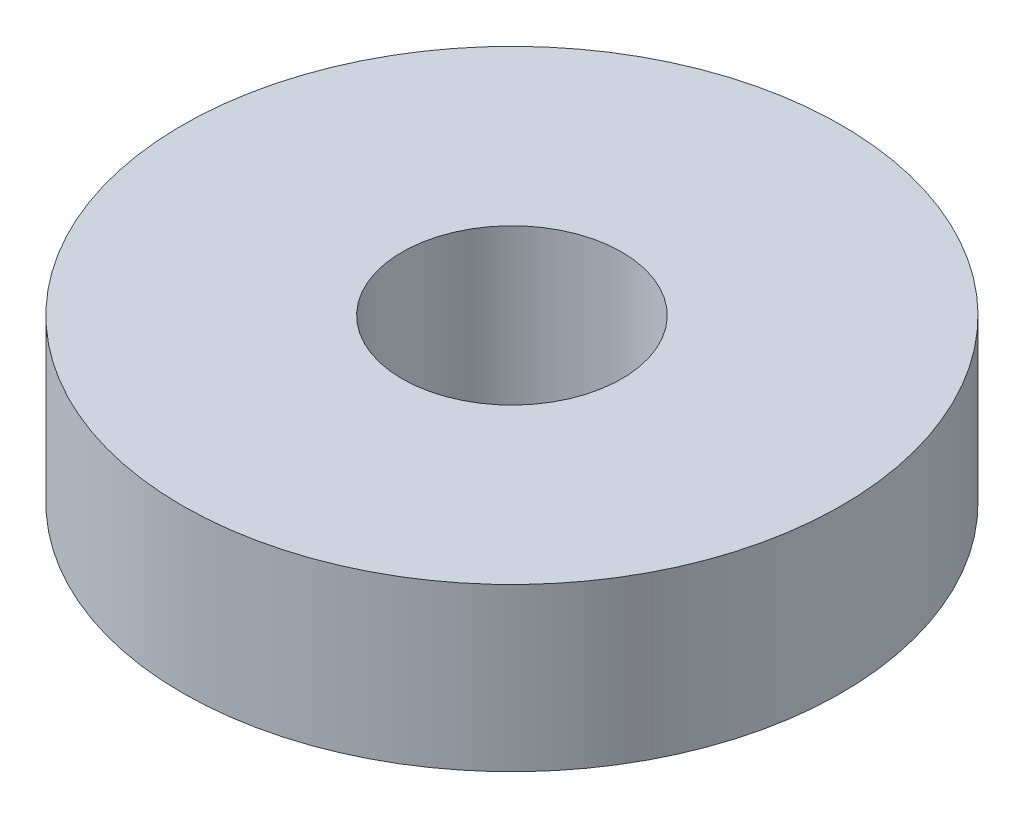
from build123d import *

# Parameters (mm, degrees)
SKETCH1_R           = 22.5
SKETCH1_R_2         = 7.5
BOSS_EXTRUDE1_DEPTH = 11.07


with BuildPart() as part:
    # Sketch1 → Boss-Extrude1 (new body)
    with BuildSketch(Plane(origin=(0, 0, 0), x_dir=(1, 0, 0), z_dir=(0, 1, 0))):
        Circle(SKETCH1_R)
        Circle(SKETCH1_R_2, mode=Mode.SUBTRACT)
    extrude(amount=BOSS_EXTRUDE1_DEPTH)


solid = part.part
